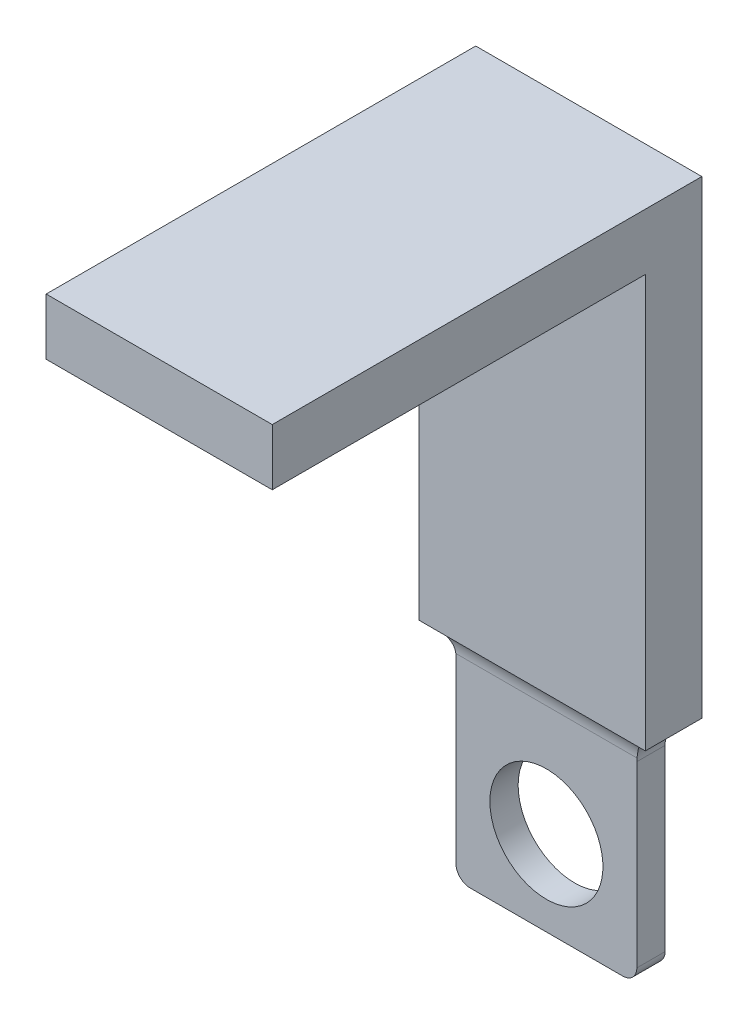
from build123d import *

# Parameters (mm, degrees)
SZKIC1_W                    = 4
SZKIC1_H                    = 1
DODANIE_WYCI_GNI_CIE1_DEPTH = 8.3
SZKIC2_W                    = 4
SZKIC2_H                    = 1
DODANIE_WYCI_GNI_CIE2_DEPTH = 6.6
SZKIC3_W                    = 3.2
SZKIC3_H                    = 0.5
DODANIE_WYCI_GNI_CIE3_DEPTH = 3.9
ZAOKR_GLENIE1_R             = 0.5
ZAOKR_GLENIE2_R             = 0.25
SZKIC4_R                    = 1
WYTNIJ_WYCI_GNI_CIE1_DEPTH  = 3.9


with BuildPart() as part:
    # Szkic1 → Dodanie-wyciągnięcie1 (new body)
    with BuildSketch(Plane(origin=(0, 0, 0), x_dir=(1, 0, 0), z_dir=(0, 1, 0))):
        with Locations((-2, -0.5)):
            Rectangle(SZKIC1_W, SZKIC1_H)
    extrude(amount=DODANIE_WYCI_GNI_CIE1_DEPTH)

    # Szkic2 → Dodanie-wyciągnięcie2 (add)
    with BuildSketch(Plane.XY.offset(1)):
        with Locations((-2, 7.8)):
            Rectangle(SZKIC2_W, SZKIC2_H)
    extrude(amount=DODANIE_WYCI_GNI_CIE2_DEPTH)

    # Szkic3 → Dodanie-wyciągnięcie3 (add)
    with BuildSketch(Plane.XZ):
        with Locations((-2, 0.5)):
            Rectangle(SZKIC3_W, SZKIC3_H)
    extrude(amount=DODANIE_WYCI_GNI_CIE3_DEPTH)

    # Zaokrąglenie1
    # the kernel refuses this fillet: 0.5 mm, written as the material it adds along each edge
    with BuildSketch(Plane(origin=(-0.4, 0, 0.25), x_dir=(1.0, -1.5702716904537035e-12, 0), z_dir=(0, 0, 1)), Plane(origin=(-3.6, 0, 0.75), x_dir=(-1.0, -1.5702716904537041e-12, 0), z_dir=(0, 0, -1))) as zaokr_glenie1_piece_1:
        with BuildLine():
            CenterArc((0.5, -0.489897949), ZAOKR_GLENIE1_R, 101.536959033, 78.463040967)
            Line((0, -0.489897949), (-0.01, -0.489897949))
            Line((-0.01, -0.489897949), (-0.01, 0))
            Line((-0.01, 0), (0, 0.01))
            ThreePointArc((0, 0.01), (0.2, 0.01), (0.398, 0.009797959))
            Line((0.398, 0.009797959), (0.4, 0))
        make_face()
    extrude(amount=0.5)
    with BuildSketch(Plane(origin=(-0.4, 0, 0.75), x_dir=(0, 0, 1), z_dir=(-1, 0, 0)), Plane(origin=(-3.6, 0, 0.25), x_dir=(0, 0, -1), z_dir=(1, 0, 0))) as zaokr_glenie1_piece_2:
        with BuildLine():
            CenterArc((0.5, -0.433012702), ZAOKR_GLENIE1_R, 120, 60)
            Line((0, -0.433012702), (-0.01, -0.433012702))
            Line((-0.01, -0.433012702), (-0.01, 0))
            Line((-0.01, 0), (0, 0.01))
            ThreePointArc((0, 0.01), (0.125, 0.01), (0.245, 0.008660254))
            Line((0.245, 0.008660254), (0.25, 0))
        make_face()
    extrude(amount=3.2)
    with BuildSketch(Plane(origin=(-0.4, 0, -0.974744871), x_dir=(1.0, -1.5702716904537035e-12, 0), z_dir=(0, 0, 1))) as zaokr_glenie1_piece_3a_section:
        with BuildLine():
            CenterArc((0.5, -0.489897949), ZAOKR_GLENIE1_R, 101.536959033, 78.463040967)
            Line((0, -0.489897949), (-0.01, -0.489897949))
            Line((-0.01, -0.489897949), (-0.01, 0))
            Line((-0.01, 0), (0, 0.01))
            ThreePointArc((0, 0.01), (0.2, 0.01), (0.398, 0.009797959))
            Line((0.398, 0.009797959), (0.4, 0))
        make_face()
    zaokr_glenie1_piece_3a = extrude(amount=1.724744871, mode=Mode.PRIVATE)
    zaokr_glenie1_piece_3a = split(zaokr_glenie1_piece_3a, bisect_by=Plane(origin=(-0.300219951, -0.114308546, 0), z_dir=(0, 0, 1)), keep=Keep.TOP, mode=Mode.PRIVATE)
    zaokr_glenie1_piece_3a = split(zaokr_glenie1_piece_3a, bisect_by=Plane(origin=(-0.300219951, -0.114308546, 0.25), z_dir=(0, 0, -1)), keep=Keep.TOP, mode=Mode.PRIVATE)
    with BuildSketch(Plane(origin=(-3.6, 0, 0.25), x_dir=(0, 0, -1), z_dir=(1, 0, 0))) as zaokr_glenie1_piece_3b_section:
        with BuildLine():
            CenterArc((0.5, -0.433012702), ZAOKR_GLENIE1_R, 120, 60)
            Line((0, -0.433012702), (-0.01, -0.433012702))
            Line((-0.01, -0.433012702), (-0.01, 0))
            Line((-0.01, 0), (0, 0.01))
            ThreePointArc((0, 0.01), (0.125, 0.01), (0.245, 0.008660254))
            Line((0.245, 0.008660254), (0.25, 0))
        make_face()
    zaokr_glenie1_piece_3b = extrude(amount=4.282531755, mode=Mode.PRIVATE)
    zaokr_glenie1_piece_3b = split(zaokr_glenie1_piece_3b, bisect_by=Plane(origin=(0, -0.108155223, 0.185241644), z_dir=(-1, 0, 0)), keep=Keep.TOP, mode=Mode.PRIVATE)
    zaokr_glenie1_piece_3b = split(zaokr_glenie1_piece_3b, bisect_by=Plane(origin=(-0.4, -0.108155223, 0.185241644), z_dir=(1, 0, 0)), keep=Keep.TOP, mode=Mode.PRIVATE)
    zaokr_glenie1_piece_3 = zaokr_glenie1_piece_3a & zaokr_glenie1_piece_3b
    add(zaokr_glenie1_piece_3)
    with BuildSketch(Plane(origin=(0.682531755, 0, 0.75), x_dir=(0, 0, 1), z_dir=(-1, 0, 0))) as zaokr_glenie1_piece_4a_section:
        with BuildLine():
            CenterArc((0.5, -0.433012702), ZAOKR_GLENIE1_R, 120, 60)
            Line((0, -0.433012702), (-0.01, -0.433012702))
            Line((-0.01, -0.433012702), (-0.01, 0))
            Line((-0.01, 0), (0, 0.01))
            ThreePointArc((0, 0.01), (0.125, 0.01), (0.245, 0.008660254))
            Line((0.245, 0.008660254), (0.25, 0))
        make_face()
    zaokr_glenie1_piece_4a = extrude(amount=4.282531755, mode=Mode.PRIVATE)
    zaokr_glenie1_piece_4a = split(zaokr_glenie1_piece_4a, bisect_by=Plane(origin=(0, -0.108155223, 0.814758356), z_dir=(-1, 0, 0)), keep=Keep.TOP, mode=Mode.PRIVATE)
    zaokr_glenie1_piece_4a = split(zaokr_glenie1_piece_4a, bisect_by=Plane(origin=(-0.4, -0.108155223, 0.814758356), z_dir=(1, 0, 0)), keep=Keep.TOP, mode=Mode.PRIVATE)
    with BuildSketch(Plane(origin=(-0.4, 0, 0.25), x_dir=(1.0, -1.5702716904537035e-12, 0), z_dir=(0, 0, 1))) as zaokr_glenie1_piece_4b_section:
        with BuildLine():
            CenterArc((0.5, -0.489897949), ZAOKR_GLENIE1_R, 101.536959033, 78.463040967)
            Line((0, -0.489897949), (-0.01, -0.489897949))
            Line((-0.01, -0.489897949), (-0.01, 0))
            Line((-0.01, 0), (0, 0.01))
            ThreePointArc((0, 0.01), (0.2, 0.01), (0.398, 0.009797959))
            Line((0.398, 0.009797959), (0.4, 0))
        make_face()
    zaokr_glenie1_piece_4b = extrude(amount=1.724744871, mode=Mode.PRIVATE)
    zaokr_glenie1_piece_4b = split(zaokr_glenie1_piece_4b, bisect_by=Plane(origin=(-0.300219951, -0.114308546, 1), z_dir=(0, 0, -1)), keep=Keep.TOP, mode=Mode.PRIVATE)
    zaokr_glenie1_piece_4b = split(zaokr_glenie1_piece_4b, bisect_by=Plane(origin=(-0.300219951, -0.114308546, 0.75), z_dir=(0, 0, 1)), keep=Keep.TOP, mode=Mode.PRIVATE)
    zaokr_glenie1_piece_4 = zaokr_glenie1_piece_4a & zaokr_glenie1_piece_4b
    add(zaokr_glenie1_piece_4)
    with BuildSketch(Plane(origin=(-3.6, 0, 1.974744871), x_dir=(-1.0, -1.5702716904537041e-12, 0), z_dir=(0, 0, -1))) as zaokr_glenie1_piece_5a_section:
        with BuildLine():
            CenterArc((0.5, -0.489897949), ZAOKR_GLENIE1_R, 101.536959033, 78.463040967)
            Line((0, -0.489897949), (-0.01, -0.489897949))
            Line((-0.01, -0.489897949), (-0.01, 0))
            Line((-0.01, 0), (0, 0.01))
            ThreePointArc((0, 0.01), (0.2, 0.01), (0.398, 0.009797959))
            Line((0.398, 0.009797959), (0.4, 0))
        make_face()
    zaokr_glenie1_piece_5a = extrude(amount=1.724744871, mode=Mode.PRIVATE)
    zaokr_glenie1_piece_5a = split(zaokr_glenie1_piece_5a, bisect_by=Plane(origin=(-3.699780049, -0.114308546, 1), z_dir=(0, 0, -1)), keep=Keep.TOP, mode=Mode.PRIVATE)
    zaokr_glenie1_piece_5a = split(zaokr_glenie1_piece_5a, bisect_by=Plane(origin=(-3.699780049, -0.114308546, 0.75), z_dir=(0, 0, 1)), keep=Keep.TOP, mode=Mode.PRIVATE)
    with BuildSketch(Plane(origin=(-0.4, 0, 0.75), x_dir=(0, 0, 1), z_dir=(-1, 0, 0))) as zaokr_glenie1_piece_5b_section:
        with BuildLine():
            CenterArc((0.5, -0.433012702), ZAOKR_GLENIE1_R, 120, 60)
            Line((0, -0.433012702), (-0.01, -0.433012702))
            Line((-0.01, -0.433012702), (-0.01, 0))
            Line((-0.01, 0), (0, 0.01))
            ThreePointArc((0, 0.01), (0.125, 0.01), (0.245, 0.008660254))
            Line((0.245, 0.008660254), (0.25, 0))
        make_face()
    zaokr_glenie1_piece_5b = extrude(amount=4.282531755, mode=Mode.PRIVATE)
    zaokr_glenie1_piece_5b = split(zaokr_glenie1_piece_5b, bisect_by=Plane(origin=(-4, -0.108155223, 0.814758356), z_dir=(1, 0, 0)), keep=Keep.TOP, mode=Mode.PRIVATE)
    zaokr_glenie1_piece_5b = split(zaokr_glenie1_piece_5b, bisect_by=Plane(origin=(-3.6, -0.108155223, 0.814758356), z_dir=(-1, 0, 0)), keep=Keep.TOP, mode=Mode.PRIVATE)
    zaokr_glenie1_piece_5 = zaokr_glenie1_piece_5a & zaokr_glenie1_piece_5b
    add(zaokr_glenie1_piece_5)
    with BuildSketch(Plane(origin=(-3.6, 0, 0.75), x_dir=(-1.0, -1.5702716904537041e-12, 0), z_dir=(0, 0, -1))) as zaokr_glenie1_piece_6a_section:
        with BuildLine():
            CenterArc((0.5, -0.489897949), ZAOKR_GLENIE1_R, 101.536959033, 78.463040967)
            Line((0, -0.489897949), (-0.01, -0.489897949))
            Line((-0.01, -0.489897949), (-0.01, 0))
            Line((-0.01, 0), (0, 0.01))
            ThreePointArc((0, 0.01), (0.2, 0.01), (0.398, 0.009797959))
            Line((0.398, 0.009797959), (0.4, 0))
        make_face()
    zaokr_glenie1_piece_6a = extrude(amount=1.724744871, mode=Mode.PRIVATE)
    zaokr_glenie1_piece_6a = split(zaokr_glenie1_piece_6a, bisect_by=Plane(origin=(-3.699780049, -0.114308546, 0), z_dir=(0, 0, 1)), keep=Keep.TOP, mode=Mode.PRIVATE)
    zaokr_glenie1_piece_6a = split(zaokr_glenie1_piece_6a, bisect_by=Plane(origin=(-3.699780049, -0.114308546, 0.25), z_dir=(0, 0, -1)), keep=Keep.TOP, mode=Mode.PRIVATE)
    with BuildSketch(Plane(origin=(-4.682531755, 0, 0.25), x_dir=(0, 0, -1), z_dir=(1, 0, 0))) as zaokr_glenie1_piece_6b_section:
        with BuildLine():
            CenterArc((0.5, -0.433012702), ZAOKR_GLENIE1_R, 120, 60)
            Line((0, -0.433012702), (-0.01, -0.433012702))
            Line((-0.01, -0.433012702), (-0.01, 0))
            Line((-0.01, 0), (0, 0.01))
            ThreePointArc((0, 0.01), (0.125, 0.01), (0.245, 0.008660254))
            Line((0.245, 0.008660254), (0.25, 0))
        make_face()
    zaokr_glenie1_piece_6b = extrude(amount=4.282531755, mode=Mode.PRIVATE)
    zaokr_glenie1_piece_6b = split(zaokr_glenie1_piece_6b, bisect_by=Plane(origin=(-4, -0.108155223, 0.185241644), z_dir=(1, 0, 0)), keep=Keep.TOP, mode=Mode.PRIVATE)
    zaokr_glenie1_piece_6b = split(zaokr_glenie1_piece_6b, bisect_by=Plane(origin=(-3.6, -0.108155223, 0.185241644), z_dir=(-1, 0, 0)), keep=Keep.TOP, mode=Mode.PRIVATE)
    zaokr_glenie1_piece_6 = zaokr_glenie1_piece_6a & zaokr_glenie1_piece_6b
    add(zaokr_glenie1_piece_6)

    # Zaokrąglenie2
    zaokr_glenie2_edges = [part.edges().sort_by_distance(p)[0] for p in [
        (-0.4, -3.9, 0.5),
        (-3.6, -3.9, 0.5),
    ]]
    fillet(zaokr_glenie2_edges, radius=ZAOKR_GLENIE2_R)

    # Szkic4 → Wytnij-wyciągnięcie1 (cut)
    with BuildSketch(Plane(origin=(0, 0, 0.25), x_dir=(-1, 0, 0), z_dir=(0, 0, -1))):
        with Locations((2, -2.399073148)):
            Circle(SZKIC4_R)
    extrude(amount=-WYTNIJ_WYCI_GNI_CIE1_DEPTH, mode=Mode.SUBTRACT)


solid = part.part
